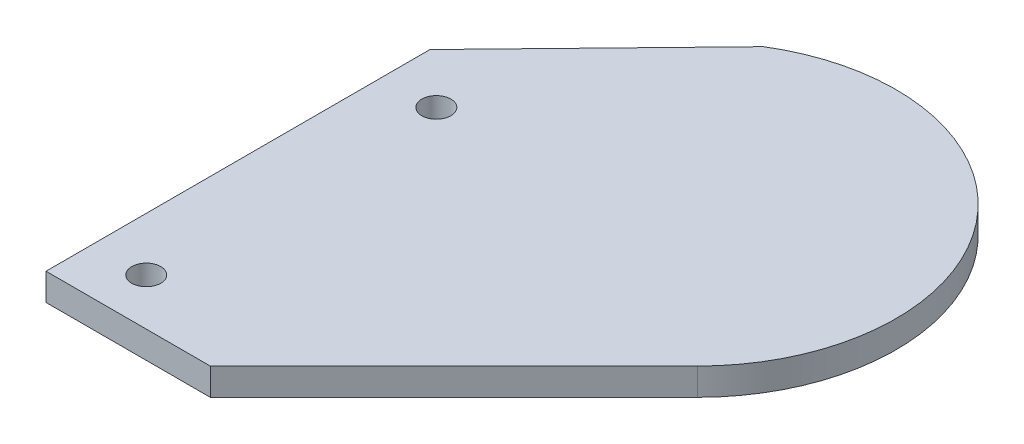
from build123d import *

# Parameters (mm, degrees)
BASE_FLANGE1_DEPTH = 6.35
SKETCH8_R          = 3.4
CUT_EXTRUDE1_DEPTH = 175.95180765


# Sheet-metal steps are written as plain solids
with BuildPart() as part:
    # Sketch2 → Base-Flange1 (new body)
    with BuildSketch(Plane(origin=(0, 0, 0), x_dir=(1, 0, 0), z_dir=(0, 1, 0))):
        with BuildLine():
            Line((0, 0), (38.51093065, 0))
            Line((38.51093065, 0), (95.630465325, 57.119534675))
            ThreePointArc((95.630465325, 57.119534675), (99.287953618, 118.761570635), (38.51093065, 129.682710556))
            Line((38.51093065, 129.682710556), (0, 90))
            Line((0, 90), (0, 0))
        make_face()
    extrude(amount=-BASE_FLANGE1_DEPTH)

    # Sketch8 → Cut-Extrude1 (cut, through all)
    with BuildSketch(Plane(origin=(0, 0, 0), x_dir=(1, 0, 0), z_dir=(0, 1, 0))):
        with Locations(Location((12.5, 79, 0), (0, 0, 270))):
            Circle(SKETCH8_R)
        with Locations(Location((12.5, 11, 0), (0, 0, 90))):
            Circle(SKETCH8_R)
    extrude(amount=-CUT_EXTRUDE1_DEPTH, mode=Mode.SUBTRACT)


solid = part.part
